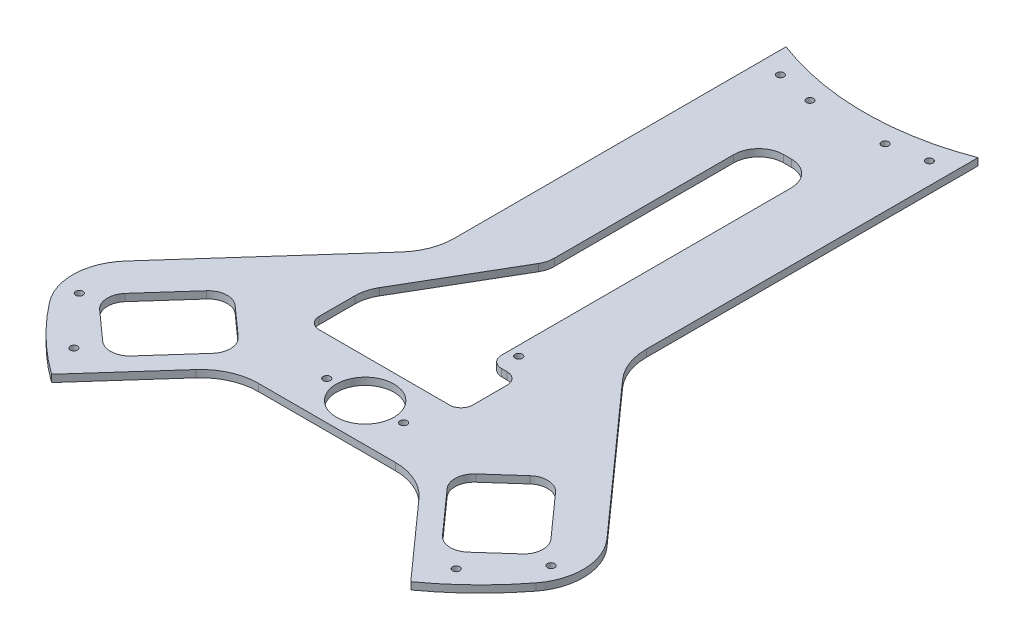
from build123d import *

# Parameters (mm, degrees)
SKETCH1_R           = 2.38125
BOSS_EXTRUDE1_DEPTH = 4.7625
SKETCH2_R           = 2.38125
CUT_EXTRUDE1_DEPTH  = 343.797654481
FILLET1_R           = 38.1
SKETCH4_R           = 2.38125
CUT_EXTRUDE3_DEPTH  = 343.797654481
FILLET2_R           = 38.1
CUT_EXTRUDE4_DEPTH  = 338.871506933
FILLET3_R           = 12.7
SKETCH6_R           = 19.05
CUT_EXTRUDE5_DEPTH  = 338.871506933
SKETCH7_W           = 38.1
SKETCH7_H           = 254
CUT_EXTRUDE6_DEPTH  = 338.871506933
SKETCH8_W           = 101.6
SKETCH8_H           = 38.1
CUT_EXTRUDE7_DEPTH  = 338.871506933
CUT_EXTRUDE8_DEPTH  = 338.871506933
FILLET4_R           = 25.4
FILLET5_R           = 7.62
FILLET8_R           = 16.51
SKETCH10_R          = 177.8
SKETCH10_R_2        = 2.38125
CUT_EXTRUDE9_DEPTH  = 338.871506933


with BuildPart() as part:
    # Sketch1 → Boss-Extrude1 (new body)
    with BuildSketch(Plane(origin=(0, 0, 0), x_dir=(1, 0, 0), z_dir=(0, 1, 0))):
        with BuildLine():
            Line((63.5, 31.75), (63.5, 292.608))
            Line((63.5, 292.608), (-63.5, 292.608))
            Line((-63.5, 292.608), (-63.5, 31.75))
            Line((-63.5, 31.75), (-178.516410583, -97.067662754))
            ThreePointArc((-178.516410583, -97.067662754), (-152.483723292, -134.309173667), (-118.826410583, -164.834838999))
            Line((-118.826410583, -164.834838999), (-62.366418607, -101.6))
            Line((-62.366418607, -101.6), (62.366418607, -101.6))
            Line((62.366418607, -101.6), (118.826410583, -164.834838999))
            ThreePointArc((118.826410583, -164.834838999), (152.483723292, -134.309173667), (178.516410583, -97.067662754))
            Line((178.516410583, -97.067662754), (63.5, 31.75))
        make_face()
        with Locations((-25.4, 0)):
            Circle(SKETCH1_R, mode=Mode.SUBTRACT)
        with Locations((25.4, 0)):
            Circle(SKETCH1_R, mode=Mode.SUBTRACT)
        with Locations((25.4, -76.2)):
            Circle(SKETCH1_R, mode=Mode.SUBTRACT)
        with Locations((-25.4, -76.2)):
            Circle(SKETCH1_R, mode=Mode.SUBTRACT)
    extrude(amount=BOSS_EXTRUDE1_DEPTH)

    # Sketch2 → Cut-Extrude1 (cut, through all)
    with BuildSketch(Plane(origin=(0, 4.7625, 0), x_dir=(1, 0, 0), z_dir=(0, 1, 0))):
        with Locations((25.4, 279.908)):
            Circle(SKETCH2_R)
        with Locations((50.8, 279.908)):
            Circle(SKETCH2_R)
        with Locations((-50.8, 279.908)):
            Circle(SKETCH2_R)
        with Locations((-25.4, 279.908)):
            Circle(SKETCH2_R)
    extrude(amount=-CUT_EXTRUDE1_DEPTH, mode=Mode.SUBTRACT)

    # Fillet1
    fillet1_edges = [part.edges().sort_by_distance(p)[0] for p in [
        (63.5, 2.38125, -31.75),
        (-63.5, 2.38125, -31.75),
        (62.366418607, 2.38125, 101.6),
        (-62.366418607, 2.38125, 101.6),
    ]]
    fillet(fillet1_edges, radius=FILLET1_R)

    # Sketch4 → Cut-Extrude3 (cut, through all)
    with BuildSketch(Plane(origin=(0, 4.7625, 0), x_dir=(1, 0, 0), z_dir=(0, 1, 0))):
        with Locations((-156.048464437, -109.266311125)):
            Circle(SKETCH4_R)
        with Locations((-126.479111192, -142.454499515)):
            Circle(SKETCH4_R)
        with Locations((126.479111192, -142.454499515)):
            Circle(SKETCH4_R)
        with Locations((156.048464437, -109.266311125)):
            Circle(SKETCH4_R)
    extrude(amount=-CUT_EXTRUDE3_DEPTH, mode=Mode.SUBTRACT)

    # Fillet2
    fillet2_edges = [part.edges().sort_by_distance(p)[0] for p in [
        (178.516410583, 2.38125, 97.067662754),
        (-178.516410583, 2.38125, 97.067662754),
    ]]
    fillet(fillet2_edges, radius=FILLET2_R)

    # Sketch5 → Cut-Extrude4 (cut, through all)
    with BuildSketch(Plane(origin=(0, 4.7625, 0), x_dir=(1, 0, 0), z_dir=(0, 1, 0))):
        Polygon((-149.276482194, -103.59593683), (-111.382942554, -137.429642709), (-69.090810204, -90.062718159), (-106.984349844, -56.22901228), align=None)
        Polygon((106.984349844, -56.22901228), (69.090810204, -90.062718159), (111.382942554, -137.429642709), (149.276482194, -103.59593683), align=None)
    extrude(amount=-CUT_EXTRUDE4_DEPTH, mode=Mode.SUBTRACT)

    # Fillet3
    fillet3_edges = [part.edges().sort_by_distance(p)[0] for p in [
        (111.382942554, 2.38125, 137.429642709),
        (69.090810204, 2.38125, 90.062718159),
        (106.984349844, 2.38125, 56.22901228),
        (149.276482194, 2.38125, 103.59593683),
        (-69.090810204, 2.38125, 90.062718159),
        (-106.984349844, 2.38125, 56.22901228),
        (-149.276482194, 2.38125, 103.59593683),
        (-111.382942554, 2.38125, 137.429642709),
    ]]
    fillet(fillet3_edges, radius=FILLET3_R)

    # Sketch6 → Cut-Extrude5 (cut, through all)
    with BuildSketch(Plane(origin=(0, 4.7625, 0), x_dir=(1, 0, 0), z_dir=(0, 1, 0))):
        with Locations((0, -76.2)):
            Circle(SKETCH6_R)
    extrude(amount=-CUT_EXTRUDE5_DEPTH, mode=Mode.SUBTRACT)

    # Sketch7 → Cut-Extrude6 (cut, through all)
    with BuildSketch(Plane(origin=(0, 4.7625, 0), x_dir=(1, 0, 0), z_dir=(0, 1, 0))):
        with Locations((0, 76.2)):
            Rectangle(SKETCH7_W, SKETCH7_H)
    extrude(amount=-CUT_EXTRUDE6_DEPTH, mode=Mode.SUBTRACT)

    # Sketch8 → Cut-Extrude7 (cut, through all)
    with BuildSketch(Plane(origin=(0, 4.7625, 0), x_dir=(1, 0, 0), z_dir=(0, 1, 0))):
        with Locations((-12.7, -31.75)):
            Rectangle(SKETCH8_W, SKETCH8_H)
    extrude(amount=-CUT_EXTRUDE7_DEPTH, mode=Mode.SUBTRACT)

    # Sketch9 → Cut-Extrude8 (cut, through all)
    with BuildSketch(Plane(origin=(0, 4.7625, 0), x_dir=(1, 0, 0), z_dir=(0, 1, 0))):
        Polygon((-63.5, -12.7), (-19.05, 63.5), (-19.05, -12.7), align=None)
    extrude(amount=-CUT_EXTRUDE8_DEPTH, mode=Mode.SUBTRACT)

    # Fillet4
    fillet4_edges = [part.edges().sort_by_distance(p)[0] for p in [
        (-63.5, 2.38125, 12.7),
    ]]
    fillet(fillet4_edges, radius=FILLET4_R)

    # Fillet5
    fillet5_edges = [part.edges().sort_by_distance(p)[0] for p in [
        (-63.5, 2.38125, 50.8),
        (38.1, 2.38125, 50.8),
        (38.1, 2.38125, 12.7),
        (19.05, 2.38125, 12.7),
    ]]
    fillet(fillet5_edges, radius=FILLET5_R)

    # Fillet8
    fillet8_edges = [part.edges().sort_by_distance(p)[0] for p in [
        (-19.05, 2.38125, -203.2),
        (19.05, 2.38125, -203.2),
        (-19.05, 2.38125, -63.5),
    ]]
    fillet(fillet8_edges, radius=FILLET8_R)

    # Sketch10 → Cut-Extrude9 (cut, through all)
    with BuildSketch(Plane(origin=(0, 4.7625, 0), x_dir=(1, 0, 0), z_dir=(0, 1, 0))):
        with Locations((0, 431.8)):
            Circle(SKETCH10_R)
        with Locations((-49.305028092, 247.791130092)):
            Circle(SKETCH10_R_2)
        with Locations((-24.865239618, 242.929753908)):
            Circle(SKETCH10_R_2)
        with Locations((24.865239618, 242.929753908)):
            Circle(SKETCH10_R_2)
        with Locations((49.305028092, 247.791130092)):
            Circle(SKETCH10_R_2)
    extrude(amount=-CUT_EXTRUDE9_DEPTH, mode=Mode.SUBTRACT)


solid = part.part
